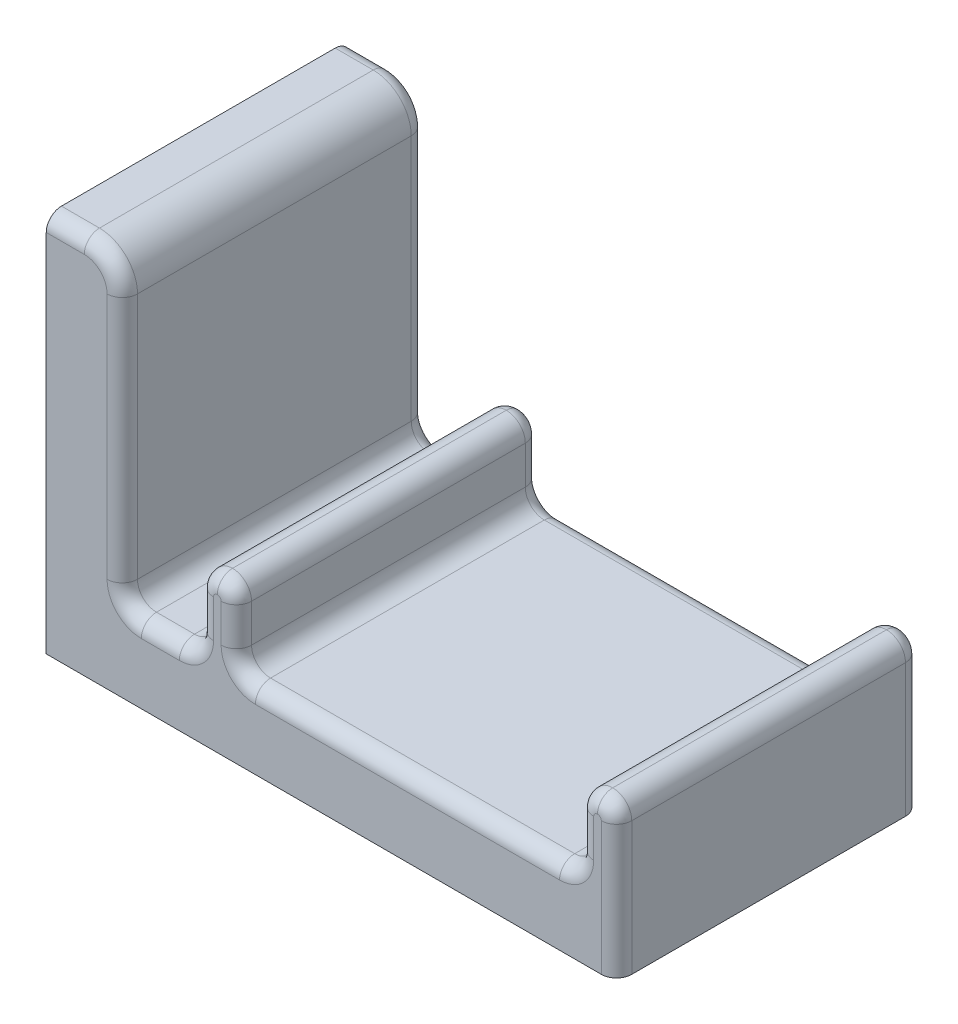
from build123d import *

# Parameters (mm, degrees)
SKETCH_1_W      = 10
SKETCH_1_H      = 40
SKETCH_1_W_2    = 5
SKETCH_1_H_2    = 10
EXTRUDE_1_DEPTH = 40
FILLET_2_R      = 5
FILLET_3_R      = 2.5
FILLET_4_R      = 2.5
FILLET_6_R      = 2


with BuildPart() as part:
    # 草圖1 → 填料-伸長1 (new body)
    with BuildSketch(Plane.XY):
        with Locations((-34.732391425, 13.59375)):
            Rectangle(SKETCH_1_W, SKETCH_1_H)
        Polygon((-29.732391425, -6.40625), (-39.732391425, -6.40625), (-39.732391425, -16.40625), (35.267608575, -16.40625), (35.267608575, -6.40625), (30.267608575, -6.40625), (-14.732391425, -6.40625), (-19.732391425, -6.40625), align=None)
        with Locations((-17.232391425, -1.40625)):
            Rectangle(SKETCH_1_W_2, SKETCH_1_H_2)
        with Locations((32.767608575, -1.40625)):
            Rectangle(SKETCH_1_W_2, SKETCH_1_H_2)
    extrude(amount=EXTRUDE_1_DEPTH)

    # 圓角2
    fillet_2_edges = [part.edges().sort_by_distance(p)[0] for p in [
        (-29.732391425, 33.59375, 20),
    ]]
    fillet(fillet_2_edges, radius=FILLET_2_R)

    # 圓角3
    fillet_3_edges = [part.edges().sort_by_distance(p)[0] for p in [
        (-29.732391425, -6.40625, 20),
        (-19.732391425, -6.40625, 20),
    ]]
    fillet(fillet_3_edges, radius=FILLET_3_R)

    # 圓角4
    fillet_4_edges = [part.edges().sort_by_distance(p)[0] for p in [
        (30.267608575, -6.40625, 20),
        (30.267608575, 3.59375, 20),
        (35.267608575, 3.59375, 20),
        (-14.732391425, -6.40625, 20),
        (-14.732391425, 3.59375, 20),
        (-19.732391425, 3.59375, 20),
    ]]
    fillet(fillet_4_edges, radius=FILLET_4_R - 0.0001)  # a hair under: the kernel refuses the full size

    # 圓角6
    fillet_6_edges = [part.edges().sort_by_distance(p)[0] for p in [
        (-37.232391425, 33.59375, 40),
        (-37.232391425, 33.59375, 0),
        (-29.732391425, 12.34375, 0),
        (-31.196857519, 32.129283906, 0),
        (-29.732391425, 12.34375, 40),
        (-31.196857519, 32.129283906, 40),
        (-19.732391425, -1.4062, 0),
        (-19.732391425, -1.4062, 40),
        (-24.732391425, -6.40625, 0),
        (-24.732391425, -6.40625, 40),
        (-20.464624472, -5.674016953, 40),
        (-20.464624472, -5.674016953, 0),
        (-29.000158378, -5.674016953, 0),
        (-29.000158378, -5.674016953, 40),
        (30.267608575, -1.40625, 0),
        (30.267608575, -1.40625, 40),
        (7.767608575, -6.40625, 0),
        (7.767608575, -6.40625, 40),
        (-14.732391425, -1.40625, 0),
        (35.267608575, -7.6562, 0),
        (-19.000187668, 2.861546242, 0),
        (-15.464595183, 2.861546242, 0),
        (34.535404817, 2.861546242, 0),
        (30.999812332, 2.861546242, 0),
        (35.267608575, -7.6562, 40),
        (-14.732391425, -1.40625, 40),
        (-19.000187668, 2.861546242, 40),
        (-15.464595183, 2.861546242, 40),
        (34.535404817, 2.861546242, 40),
        (30.999812332, 2.861546242, 40),
        (29.535404817, -5.674046242, 40),
        (29.535404817, -5.674046242, 0),
        (-14.000187668, -5.674046242, 40),
        (-14.000187668, -5.674046242, 0),
    ]]
    fillet(fillet_6_edges, radius=FILLET_6_R)


solid = part.part
